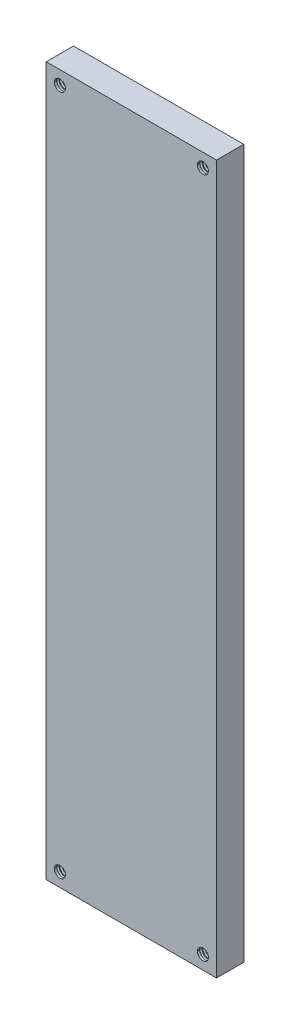
from build123d import *
from build123d.topology import SkipClean

# Parameters (mm, degrees)
SKETCH1_W           = 39.6875
SKETCH1_H           = 165.1
SKETCH1_R           = 1.28905
BOSS_EXTRUDE1_DEPTH = 6.35
THREAD1_PITCH       = 0.635
THREAD2_PITCH       = 0.635
THREAD3_PITCH       = 0.635
THREAD4_PITCH       = 0.635


with BuildPart() as part:
    # Sketch1 → Boss-Extrude1 (new body)
    with BuildSketch(Plane.XY):
        with Locations((19.84375, 82.55)):
            Rectangle(SKETCH1_W, SKETCH1_H)
        with Locations((36.5125, 161.925)):
            Circle(SKETCH1_R, mode=Mode.SUBTRACT)
        with Locations((36.5125, 3.175)):
            Circle(SKETCH1_R, mode=Mode.SUBTRACT)
        with Locations((3.175, 3.175)):
            Circle(SKETCH1_R, mode=Mode.SUBTRACT)
        with Locations((3.175, 161.925)):
            Circle(SKETCH1_R, mode=Mode.SUBTRACT)
    extrude(amount=-BOSS_EXTRUDE1_DEPTH)

    # Thread1: the profile of Thread Profile1 profile screwed along a right-hand helix of 10 turns, 6 arcs to a turn; built about Z, then put on its axis
    with SkipClean():  # the faces are left unmerged after this step: merging them gives an invalid solid
        thread1_z = Axis((0, 0, 0), (0, 0, 1))
        thread1_corners = [(1.28875, 0, -0.000173205), (1.632753831, 0, 0.198437499), (1.632753831, 0, 0.277812499), (1.28875, 0, 0.476423203)]
        with BuildLine(mode=Mode.PRIVATE) as thread1_profile:
            Line(thread1_corners[0], thread1_corners[1])
            Line(thread1_corners[1], thread1_corners[2])
            Line(thread1_corners[2], thread1_corners[3])
            Line(thread1_corners[3], thread1_corners[0])
        thread1_cap = Face(thread1_profile.wire())
        thread1_turn_angles = [0, 30, 60, 90, 120, 150, 180, 210, 240, 270, 300, 330, 360]
        thread1_turn_weights = [1, 0.8660254037844387, 1, 0.8660254037844387, 1, 0.8660254037844387, 1, 0.8660254037844387, 1, 0.8660254037844387, 1, 0.8660254037844387, 1]
        thread1_turn_rails = [Edge.make_bspline([Vector(p[0], p[1], 0).rotate(thread1_z, thread1_turn_angles[k]) / thread1_turn_weights[k] + Vector(0, 0, p[2] + THREAD1_PITCH * thread1_turn_angles[k] / 360) for k in range(13)], [0, 0, 0, 1, 1, 2, 2, 3, 3, 4, 4, 5, 5, 6, 6, 6], 2, thread1_turn_weights) for p in thread1_corners]
        thread1_turn_sides = [Face.make_surface_from_curves(thread1_turn_rails[p[0]], thread1_turn_rails[p[1]]) for p in [(0, 1), (1, 2), (2, 3), (3, 0)]]
        thread1 = Plane(origin=(3.175, 161.925, 0), x_dir=(-1, 0, 0), z_dir=(0, 0, -1)) * Solid(Shell([*[p.moved(Location((0, 0, THREAD1_PITCH * i))) for i in range(10) for p in thread1_turn_sides], thread1_cap, thread1_cap.rotate(thread1_z, 3600).moved(Location((0, 0, THREAD1_PITCH * 3600 / 360)))]))
        add(thread1, mode=Mode.SUBTRACT)

    # Thread2: the profile of Thread Profile2 profile screwed along a right-hand helix of 10 turns, 6 arcs to a turn; built about Z, then put on its axis
    with SkipClean():  # the faces are left unmerged after this step: merging them gives an invalid solid
        thread2_z = Axis((0, 0, 0), (0, 0, 1))
        thread2_corners = [(1.28875, 0, -0.000173205), (1.632753831, 0, 0.198437499), (1.632753831, 0, 0.277812499), (1.28875, 0, 0.476423203)]
        with BuildLine(mode=Mode.PRIVATE) as thread2_profile:
            Line(thread2_corners[0], thread2_corners[1])
            Line(thread2_corners[1], thread2_corners[2])
            Line(thread2_corners[2], thread2_corners[3])
            Line(thread2_corners[3], thread2_corners[0])
        thread2_cap = Face(thread2_profile.wire())
        thread2_turn_angles = [0, 30, 60, 90, 120, 150, 180, 210, 240, 270, 300, 330, 360]
        thread2_turn_weights = [1, 0.8660254037844387, 1, 0.8660254037844387, 1, 0.8660254037844387, 1, 0.8660254037844387, 1, 0.8660254037844387, 1, 0.8660254037844387, 1]
        thread2_turn_rails = [Edge.make_bspline([Vector(p[0], p[1], 0).rotate(thread2_z, thread2_turn_angles[k]) / thread2_turn_weights[k] + Vector(0, 0, p[2] + THREAD2_PITCH * thread2_turn_angles[k] / 360) for k in range(13)], [0, 0, 0, 1, 1, 2, 2, 3, 3, 4, 4, 5, 5, 6, 6, 6], 2, thread2_turn_weights) for p in thread2_corners]
        thread2_turn_sides = [Face.make_surface_from_curves(thread2_turn_rails[p[0]], thread2_turn_rails[p[1]]) for p in [(0, 1), (1, 2), (2, 3), (3, 0)]]
        thread2 = Plane(origin=(36.5125, 161.925, 0), x_dir=(-1, 0, 0), z_dir=(0, 0, -1)) * Solid(Shell([*[p.moved(Location((0, 0, THREAD2_PITCH * i))) for i in range(10) for p in thread2_turn_sides], thread2_cap, thread2_cap.rotate(thread2_z, 3600).moved(Location((0, 0, THREAD2_PITCH * 3600 / 360)))]))
        add(thread2, mode=Mode.SUBTRACT)

    # Thread3: the profile of Thread Profile4 profile screwed along a right-hand helix of 10 turns, 6 arcs to a turn; built about Z, then put on its axis
    with SkipClean():  # the faces are left unmerged after this step: merging them gives an invalid solid
        thread3_z = Axis((0, 0, 0), (0, 0, 1))
        thread3_corners = [(1.28875, 0, -0.000173205), (1.632753831, 0, 0.198437499), (1.632753831, 0, 0.277812499), (1.28875, 0, 0.476423203)]
        with BuildLine(mode=Mode.PRIVATE) as thread3_profile:
            Line(thread3_corners[0], thread3_corners[1])
            Line(thread3_corners[1], thread3_corners[2])
            Line(thread3_corners[2], thread3_corners[3])
            Line(thread3_corners[3], thread3_corners[0])
        thread3_cap = Face(thread3_profile.wire())
        thread3_turn_angles = [0, 30, 60, 90, 120, 150, 180, 210, 240, 270, 300, 330, 360]
        thread3_turn_weights = [1, 0.8660254037844387, 1, 0.8660254037844387, 1, 0.8660254037844387, 1, 0.8660254037844387, 1, 0.8660254037844387, 1, 0.8660254037844387, 1]
        thread3_turn_rails = [Edge.make_bspline([Vector(p[0], p[1], 0).rotate(thread3_z, thread3_turn_angles[k]) / thread3_turn_weights[k] + Vector(0, 0, p[2] + THREAD3_PITCH * thread3_turn_angles[k] / 360) for k in range(13)], [0, 0, 0, 1, 1, 2, 2, 3, 3, 4, 4, 5, 5, 6, 6, 6], 2, thread3_turn_weights) for p in thread3_corners]
        thread3_turn_sides = [Face.make_surface_from_curves(thread3_turn_rails[p[0]], thread3_turn_rails[p[1]]) for p in [(0, 1), (1, 2), (2, 3), (3, 0)]]
        thread3 = Plane(origin=(3.175, 3.175, 0), x_dir=(-1, 0, 0), z_dir=(0, 0, -1)) * Solid(Shell([*[p.moved(Location((0, 0, THREAD3_PITCH * i))) for i in range(10) for p in thread3_turn_sides], thread3_cap, thread3_cap.rotate(thread3_z, 3600).moved(Location((0, 0, THREAD3_PITCH * 3600 / 360)))]))
        add(thread3, mode=Mode.SUBTRACT)

    # Thread4: the profile of Thread Profile5 profile screwed along a right-hand helix of 10 turns, 6 arcs to a turn; built about Z, then put on its axis
    with SkipClean():  # the faces are left unmerged after this step: merging them gives an invalid solid
        thread4_z = Axis((0, 0, 0), (0, 0, 1))
        thread4_corners = [(1.28875, 0, -0.000173205), (1.632753831, 0, 0.198437499), (1.632753831, 0, 0.277812499), (1.28875, 0, 0.476423203)]
        with BuildLine(mode=Mode.PRIVATE) as thread4_profile:
            Line(thread4_corners[0], thread4_corners[1])
            Line(thread4_corners[1], thread4_corners[2])
            Line(thread4_corners[2], thread4_corners[3])
            Line(thread4_corners[3], thread4_corners[0])
        thread4_cap = Face(thread4_profile.wire())
        thread4_turn_angles = [0, 30, 60, 90, 120, 150, 180, 210, 240, 270, 300, 330, 360]
        thread4_turn_weights = [1, 0.8660254037844387, 1, 0.8660254037844387, 1, 0.8660254037844387, 1, 0.8660254037844387, 1, 0.8660254037844387, 1, 0.8660254037844387, 1]
        thread4_turn_rails = [Edge.make_bspline([Vector(p[0], p[1], 0).rotate(thread4_z, thread4_turn_angles[k]) / thread4_turn_weights[k] + Vector(0, 0, p[2] + THREAD4_PITCH * thread4_turn_angles[k] / 360) for k in range(13)], [0, 0, 0, 1, 1, 2, 2, 3, 3, 4, 4, 5, 5, 6, 6, 6], 2, thread4_turn_weights) for p in thread4_corners]
        thread4_turn_sides = [Face.make_surface_from_curves(thread4_turn_rails[p[0]], thread4_turn_rails[p[1]]) for p in [(0, 1), (1, 2), (2, 3), (3, 0)]]
        thread4 = Plane(origin=(36.5125, 3.175, 0), x_dir=(-1, 0, 0), z_dir=(0, 0, -1)) * Solid(Shell([*[p.moved(Location((0, 0, THREAD4_PITCH * i))) for i in range(10) for p in thread4_turn_sides], thread4_cap, thread4_cap.rotate(thread4_z, 3600).moved(Location((0, 0, THREAD4_PITCH * 3600 / 360)))]))
        add(thread4, mode=Mode.SUBTRACT)


solid = part.part
